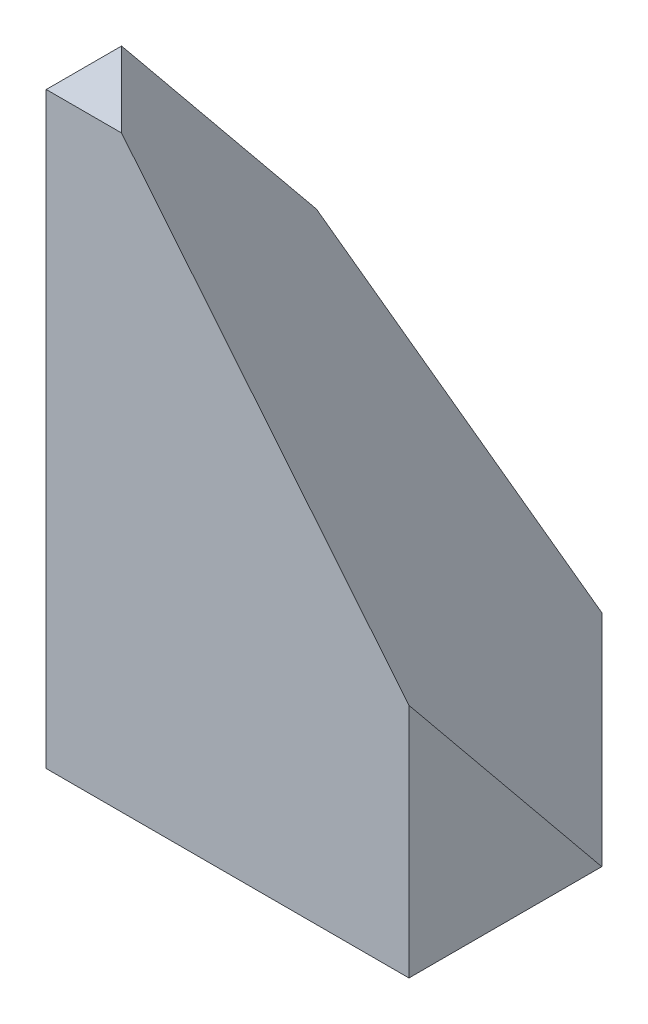
from build123d import *

# Parameters (mm, degrees)
SKETCH1_W           = 14
SKETCH1_H           = 16
BOSS_EXTRUDE1_DEPTH = 22.7
SKETCH2_W           = 50.012416784
SKETCH2_H           = 57.752903126
CUT_EXTRUDE1_DEPTH  = 20.739193493
SKETCH3_W           = 51.914221049
SKETCH3_H           = 77.87341782
CUT_EXTRUDE2_DEPTH  = 32.63570303


with BuildPart() as part:
    # Sketch1 → Boss-Extrude1 (new body)
    with BuildSketch(Plane(origin=(0, 0, 0), x_dir=(1, 0, 0), z_dir=(0, 1, 0))):
        with Locations((7, 8)):
            Rectangle(SKETCH1_W, SKETCH1_H)
    extrude(amount=BOSS_EXTRUDE1_DEPTH)

    # Sketch2 → Cut-Extrude1 (cut, through all)
    with BuildSketch(Plane(origin=(8.040425957, 6.564980303, -8.040425957), x_dir=(0.7905694150420965, -0.3872983346207431, 0.4743416490252531), z_dir=(-0.6123724356957925, -0.5000000000000046, 0.6123724356957929))):
        Rectangle(SKETCH2_W, SKETCH2_H)
    extrude(amount=-CUT_EXTRUDE1_DEPTH, mode=Mode.SUBTRACT)

    # Sketch3 → Cut-Extrude2 (cut, through all)
    with BuildSketch(Plane(origin=(-5.214718626, 0, -5.214718626), x_dir=(-0.7071067811865477, 1.1647906493830996e-15, 0.7071067811865475), z_dir=(-0.7071067811865475, -1.1647906493831003e-15, -0.7071067811865477))):
        with Locations((-7.620800541, 13.085295992)):
            Rectangle(SKETCH3_W, SKETCH3_H)
    extrude(amount=CUT_EXTRUDE2_DEPTH, mode=Mode.SUBTRACT)


solid = part.part
